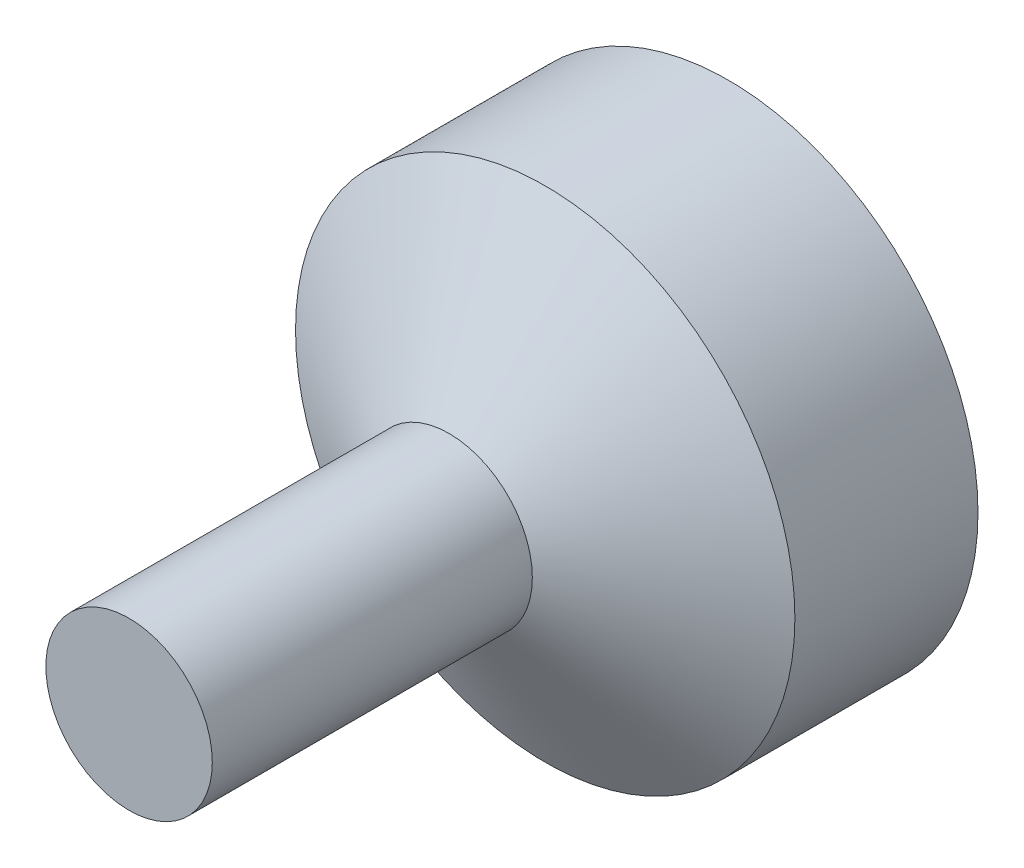
from build123d import *

# Parameters (mm, degrees)
BOSS_EXTRUDE1_DEPTH      = 250
BOSS_EXTRUDE1_DEPTH_BACK = 250
SKETCH1_R                = 100
SKETCH2_R                = 300
BOSS_EXTRUDE2_DEPTH      = 220
CHAMFER1_SIZE2           = 115.470053838
CHAMFER1_SIZE            = 200


with BuildPart() as part:
    # Sketch1 → Boss-Extrude1 (new, two sides: drawn at the far end of the back side and taken through both)
    with BuildSketch(Plane.XY.offset(-BOSS_EXTRUDE1_DEPTH_BACK)):
        Circle(SKETCH1_R)
    extrude(amount=BOSS_EXTRUDE1_DEPTH + BOSS_EXTRUDE1_DEPTH_BACK)

    # Sketch2 → Boss-Extrude2 (add)
    with BuildSketch(Plane(origin=(0, 0, -250), x_dir=(-1, 0, 0), z_dir=(0, 0, -1))):
        Circle(SKETCH2_R)
    extrude(amount=BOSS_EXTRUDE2_DEPTH)

    # Chamfer1
    chamfer1_edges = [part.edges().sort_by_distance(p)[0] for p in [
        (-100, 0, -250),
    ]]
    chamfer1_side = [part.faces().sort_by_distance(p)[0] for p in [
        (-102.309401077, 0, -250),
    ]]
    chamfer(chamfer1_edges, length=CHAMFER1_SIZE - 0.0001, length2=CHAMFER1_SIZE2 - 0.0001, reference=chamfer1_side[0])  # a hair under: the kernel refuses the full size


with BuildPart() as part_1:
    # Body-Move/Copy1: moved
    add(part.part.moved(Location((0, 0, 360))))


solid = part_1.part
